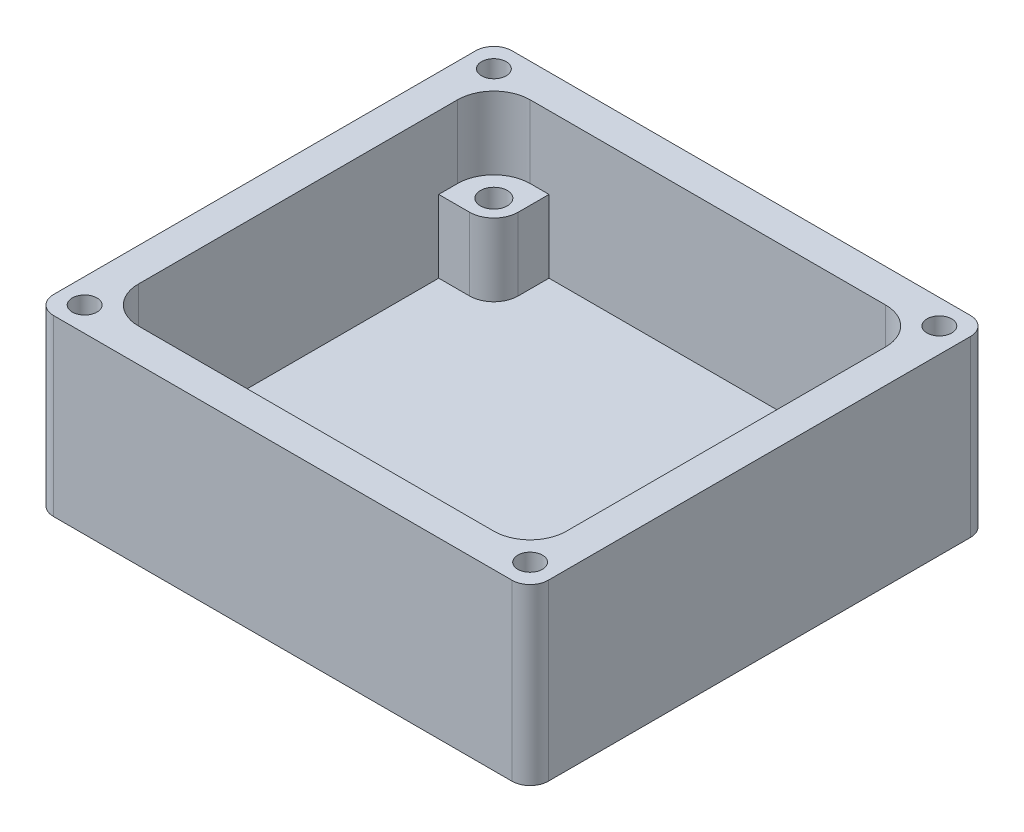
from build123d import *

# Parameters (mm, degrees)
EXTRUDE_2_DEPTH     = 20
EXTRUDE_START       = 4
EXTRUDE_3_DEPTH     = 4
SKETCH_3_R          = 1.85
EXTRUDE_4_DEPTH     = 10
SKETCH_4_R          = 1.7
CUT_EXTRUDE_1_DEPTH = 53.319881498


with BuildPart() as part:
    # ｽｹｯﾁ1 → ﾎﾞｽ - 押し出し2 (new body)
    with BuildSketch(Plane(origin=(0, 0, 0), x_dir=(1, 0, 0), z_dir=(0, 1, 0))):
        with BuildLine():
            Line((31.6, 31.6), (-31.6, 31.6))
            ThreePointArc((-31.6, 31.6), (-33.367766953, 30.867766953), (-34.1, 29.1))
            Line((-34.1, 29.1), (-34.1, -29.1))
            ThreePointArc((-34.1, -29.1), (-33.367766953, -30.867766953), (-31.6, -31.6))
            Line((-31.6, -31.6), (31.6, -31.6))
            ThreePointArc((31.6, -31.6), (33.367766953, -30.867766953), (34.1, -29.1))
            Line((34.1, -29.1), (34.1, 29.1))
            ThreePointArc((34.1, 29.1), (33.367766953, 30.867766953), (31.6, 31.6))
        make_face()
        with BuildLine():
            Line((24.5, 27), (-24.5, 27))
            ThreePointArc((-24.5, 27), (-28.035533906, 25.535533906), (-29.5, 22))
            Line((-29.5, 22), (-29.5, -22))
            ThreePointArc((-29.5, -22), (-28.035533906, -25.535533906), (-24.5, -27))
            Line((-24.5, -27), (24.5, -27))
            ThreePointArc((24.5, -27), (28.035533906, -25.535533906), (29.5, -22))
            Line((29.5, -22), (29.5, 22))
            ThreePointArc((29.5, 22), (28.035533906, 25.535533906), (24.5, 27))
        make_face(mode=Mode.SUBTRACT)
    extrude(amount=EXTRUDE_2_DEPTH)

    # ｽｹｯﾁ2 → ﾎﾞｽ - 押し出し3 (add)
    with BuildSketch(Plane.XZ.offset(EXTRUDE_START)):
        with BuildLine():
            Line((34.1, -29.1), (34.1, 29.1))
            ThreePointArc((34.1, 29.1), (33.367766953, 30.867766953), (31.6, 31.6))
            Line((31.6, 31.6), (-31.6, 31.6))
            ThreePointArc((-31.6, 31.6), (-33.367766953, 30.867766953), (-34.1, 29.1))
            Line((-34.1, 29.1), (-34.1, -29.1))
            ThreePointArc((-34.1, -29.1), (-33.367766953, -30.867766953), (-31.6, -31.6))
            Line((-31.6, -31.6), (31.6, -31.6))
            ThreePointArc((31.6, -31.6), (33.367766953, -30.867766953), (34.1, -29.1))
        make_face()
    extrude(amount=-EXTRUDE_3_DEPTH)

    # ｽｹｯﾁ3 → ﾎﾞｽ - 押し出し4 (add)
    # profile 1 of 4: a face of its own
    with BuildSketch(Plane(origin=(0, 0, 0), x_dir=(1, 0, 0), z_dir=(0, 1, 0))):
        with BuildLine():
            ThreePointArc((-21.9, -22.75), (-22.881192283, -20.381192283), (-25.25, -19.4))
            Line((-25.25, -19.4), (-29.5, -19.4))
            Line((-29.5, -19.4), (-29.5, -22))
            ThreePointArc((-29.5, -22), (-28.035533906, -25.535533906), (-24.5, -27))
            Line((-24.5, -27), (-21.9, -27))
            Line((-21.9, -27), (-21.9, -22.75))
        make_face()
        with Locations((-25.25, -22.75)):
            Circle(SKETCH_3_R, mode=Mode.SUBTRACT)
    # profile 2 of 4: a face of its own
    with BuildSketch(Plane(origin=(0, 0, 0), x_dir=(1, 0, 0), z_dir=(0, 1, 0))):
        with BuildLine():
            ThreePointArc((25.25, -19.4), (22.881192283, -20.381192283), (21.9, -22.75))
            Line((21.9, -22.75), (21.9, -27))
            Line((21.9, -27), (24.5, -27))
            ThreePointArc((24.5, -27), (28.035533906, -25.535533906), (29.5, -22))
            Line((29.5, -22), (29.5, -19.4))
            Line((29.5, -19.4), (25.25, -19.4))
        make_face()
        with Locations((25.25, -22.75)):
            Circle(SKETCH_3_R, mode=Mode.SUBTRACT)
    # profile 3 of 4: a face of its own
    with BuildSketch(Plane(origin=(0, 0, 0), x_dir=(1, 0, 0), z_dir=(0, 1, 0))):
        with BuildLine():
            Line((-29.5, 19.4), (-25.25, 19.4))
            ThreePointArc((-25.25, 19.4), (-22.881192283, 20.381192283), (-21.9, 22.75))
            Line((-21.9, 22.75), (-21.9, 27))
            Line((-21.9, 27), (-24.5, 27))
            ThreePointArc((-24.5, 27), (-28.035533906, 25.535533906), (-29.5, 22))
            Line((-29.5, 22), (-29.5, 19.4))
        make_face()
        with Locations((-25.25, 22.75)):
            Circle(SKETCH_3_R, mode=Mode.SUBTRACT)
    # profile 4 of 4: a face of its own
    with BuildSketch(Plane(origin=(0, 0, 0), x_dir=(1, 0, 0), z_dir=(0, 1, 0))):
        with BuildLine():
            ThreePointArc((21.9, 22.75), (22.881192283, 20.381192283), (25.25, 19.4))
            Line((25.25, 19.4), (29.5, 19.4))
            Line((29.5, 19.4), (29.5, 22))
            ThreePointArc((29.5, 22), (28.035533906, 25.535533906), (24.5, 27))
            Line((24.5, 27), (21.9, 27))
            Line((21.9, 27), (21.9, 22.75))
        make_face()
        with Locations((25.25, 22.75)):
            Circle(SKETCH_3_R, mode=Mode.SUBTRACT)
    extrude(amount=EXTRUDE_4_DEPTH)

    # ｽｹｯﾁ4 → ｶｯﾄ - 押し出し1 (cut, through all)
    with BuildSketch(Plane(origin=(0, 20, 0), x_dir=(1, 0, 0), z_dir=(0, 1, 0))):
        with Locations((30.701650429, -28.201650429)):
            Circle(SKETCH_4_R)
        with Locations((30.701650429, 28.201650429)):
            Circle(SKETCH_4_R)
        with Locations((-30.701650429, 28.201650429)):
            Circle(SKETCH_4_R)
        with Locations((-30.701650429, -28.201650429)):
            Circle(SKETCH_4_R)
    extrude(amount=-CUT_EXTRUDE_1_DEPTH, mode=Mode.SUBTRACT)


solid = part.part
